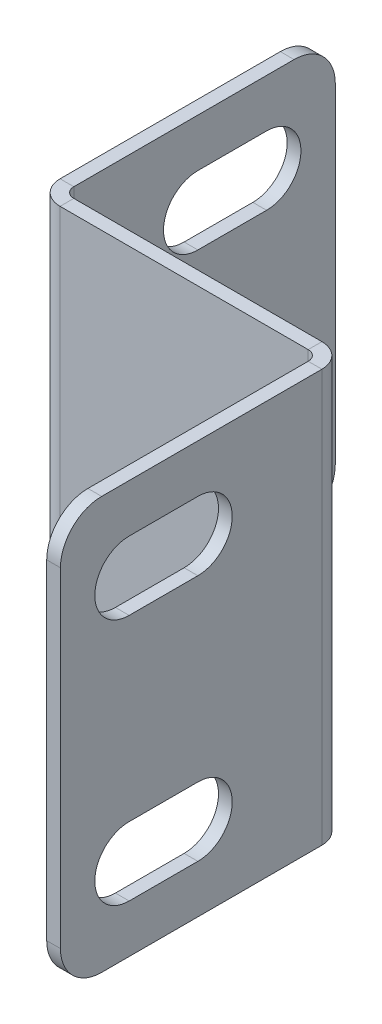
from build123d import *

# Parameters (mm, degrees)
SKETCH1_W              = 60
SKETCH1_H              = 30
BASE_FLANGE1_DEPTH     = 1
SKETCHED_START         = -15
SKETCHED_BEND1_DEPTH   = 30
SKETCHED_BEND1_2_DEPTH = 30
SKETCHED_BEND2_DEPTH   = 30
SKETCHED_BEND2_2_DEPTH = 30
CUT_EXTRUDE1_DEPTH     = 10
CUT_EXTRUDE2_DEPTH     = 10
FILLET1_R              = 3


# Read off the part's stored shape, not the designer's step: Sketched Bend1, Sketched Bend2
# Sheet-metal steps are written as plain solids
with BuildPart() as part:
    # Sketch1 → Base-Flange1 (new body)
    with BuildSketch(Plane.XY):
        Rectangle(SKETCH1_W, SKETCH1_H)
    extrude(amount=-BASE_FLANGE1_DEPTH)

    # Sketched Bend1 outline → Sketched Bend1 (cut)
    with BuildSketch(Plane(origin=(0, 0, 0), x_dir=(1, 0, 0), z_dir=(0, 1, 0)).offset(SKETCHED_START)):
        with BuildLine():
            Line((-30, 0), (9.398582279, 0))
            ThreePointArc((9.398582279, 0), (10.039397205, 0.728828115), (10.971223369, 1))
            Line((10.971223369, 1), (-30, 1))
            Line((-30, 1), (-30, 0))
        make_face()
    extrude(amount=SKETCHED_BEND1_DEPTH, mode=Mode.SUBTRACT)

    # Sketched Bend1 2 outline → Sketched Bend1 2 (add)
    with BuildSketch(Plane(origin=(0, 0, 0), x_dir=(1, 0, 0), z_dir=(0, 1, 0)).offset(SKETCHED_START)):
        with BuildLine():
            ThreePointArc((9.398582279, 0), (9.276108612, -0.359286442), (9.234623369, -0.7366))
            Line((9.234623369, -0.7366), (9.234623369, -39.765376631))
            Line((9.234623369, -39.765376631), (10.234623369, -39.765376631))
            Line((10.234623369, -39.765376631), (10.234623369, -0.7366))
            ThreePointArc((10.234623369, -0.7366), (10.450368514, -0.215745145), (10.971223369, 0))
            Line((10.971223369, 0), (9.398582279, 0))
        make_face()
    extrude(amount=SKETCHED_BEND1_2_DEPTH)

    # Sketched Bend2 outline → Sketched Bend2 (cut)
    with BuildSketch(Plane(origin=(0, 0, 0), x_dir=(1, 0, 0), z_dir=(0, 1, 0)).offset(SKETCHED_START)):
        with BuildLine():
            Line((9.234623369, -0.7366), (9.234623369, -19.16395891))
            ThreePointArc((9.234623369, -19.16395891), (9.963451484, -19.804773836), (10.234623369, -20.7366))
            Line((10.234623369, -20.7366), (10.234623369, -0.7366))
            ThreePointArc((10.234623369, -0.7366), (10.450368514, -0.215745145), (10.971223369, 0))
            Line((10.971223369, 0), (30, 0))
            Line((30, 0), (30, 1))
            Line((30, 1), (10.971223369, 1))
            ThreePointArc((10.971223369, 1), (9.743261733, 0.491361636), (9.234623369, -0.7366))
        make_face()
    extrude(amount=SKETCHED_BEND2_DEPTH, mode=Mode.SUBTRACT)

    # Sketched Bend2 2 outline → Sketched Bend2 2 (add)
    with BuildSketch(Plane(origin=(0, 0, 0), x_dir=(1, 0, 0), z_dir=(0, 1, 0)).offset(SKETCHED_START)):
        with BuildLine():
            ThreePointArc((-11.296129893, -18.2634), (-10.78749153, -19.491361636), (-9.559529893, -20))
            Line((-9.559529893, -20), (8.498023369, -20))
            ThreePointArc((8.498023369, -20), (9.018878224, -20.215745145), (9.234623369, -20.7366))
            Line((9.234623369, -20.7366), (9.234623369, -19.16395891))
            ThreePointArc((9.234623369, -19.16395891), (8.875336927, -19.041485243), (8.498023369, -19))
            Line((8.498023369, -19), (-9.559529893, -19))
            ThreePointArc((-9.559529893, -19), (-10.080384748, -18.784254855), (-10.296129893, -18.2634))
            Line((-10.296129893, -18.2634), (-10.296129893, 0.765376631))
            Line((-10.296129893, 0.765376631), (-11.296129893, 0.765376631))
            Line((-11.296129893, 0.765376631), (-11.296129893, -18.2634))
        make_face()
    extrude(amount=SKETCHED_BEND2_2_DEPTH)

    # Sketch8 → Cut-Extrude1 (cut)
    with BuildSketch(Plane(origin=(10.234623369, 0, 0), x_dir=(0, 0, -1), z_dir=(1, 0, 0))):
        with BuildLine():
            Line((-34.765376631, 11.5), (-29.765376631, 11.5))
            ThreePointArc((-29.765376631, 11.5), (-27.265376631, 9), (-29.765376631, 6.5))
            Line((-29.765376631, 6.5), (-34.765376631, 6.5))
            ThreePointArc((-34.765376631, 6.5), (-37.265376631, 9), (-34.765376631, 11.5))
        make_face()
        with BuildLine():
            Line((-34.765376631, -6.5), (-29.765376631, -6.5))
            ThreePointArc((-29.765376631, -6.5), (-27.265376631, -9), (-29.765376631, -11.5))
            Line((-29.765376631, -11.5), (-34.765376631, -11.5))
            ThreePointArc((-34.765376631, -11.5), (-37.265376631, -9), (-34.765376631, -6.5))
        make_face()
    extrude(amount=-CUT_EXTRUDE1_DEPTH, mode=Mode.SUBTRACT)

    # Sketch9 → Cut-Extrude2 (cut)
    with BuildSketch(Plane(origin=(-10.296129893, 0, 0), x_dir=(0, 0, -1), z_dir=(1, 0, 0))):
        with BuildLine():
            Line((-9.234623369, 11.5), (-4.234623369, 11.5))
            ThreePointArc((-4.234623369, 11.5), (-1.734623369, 9), (-4.234623369, 6.5))
            Line((-4.234623369, 6.5), (-9.234623369, 6.5))
            ThreePointArc((-9.234623369, 6.5), (-11.734623369, 9), (-9.234623369, 11.5))
        make_face()
        with BuildLine():
            Line((-9.234623369, -6.5), (-4.234623369, -6.5))
            ThreePointArc((-4.234623369, -6.5), (-1.734623369, -9), (-4.234623369, -11.5))
            Line((-4.234623369, -11.5), (-9.234623369, -11.5))
            ThreePointArc((-9.234623369, -11.5), (-11.734623369, -9), (-9.234623369, -6.5))
        make_face()
    extrude(amount=-CUT_EXTRUDE2_DEPTH, mode=Mode.SUBTRACT)

    # Fillet1
    fillet1_edges = [part.edges().sort_by_distance(p)[0] for p in [
        (-10.796129893, 15, -0.765376631),
        (-10.796129893, -15, -0.765376631),
        (9.734623369, -15, 39.765376631),
        (9.734623369, 15, 39.765376631),
    ]]
    fillet(fillet1_edges, radius=FILLET1_R)


solid = part.part
